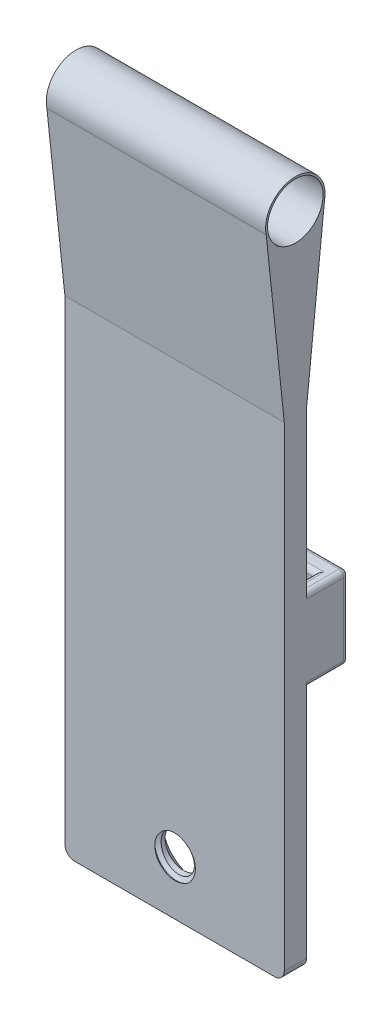
from build123d import *

# Parameters (mm, degrees)
SKETCH1_R           = 3.05
SKETCH1_R_2         = 2.85
BOSS_EXTRUDE1_DEPTH = 22.5
THREAD1_PITCH       = 0.79375
CUT_EXTRUDE1_REACH  = 73.638
SKETCH12_R          = 2.85
SKETCH13_W          = 4.3
SKETCH13_H          = 8.396908484
BOSS_EXTRUDE2_DEPTH = 22.5
CUT_EXTRUDE2_REACH  = 53.493
SKETCH14_W          = 19.5
SKETCH14_H          = 2.3
FILLET1_R           = 1
FILLET2_R           = 0.5


with BuildPart() as part:
    # Sketch1 → Boss-Extrude1 (new body)
    with BuildSketch(Plane(origin=(0, 0, 0), x_dir=(0, 0, -1), z_dir=(1, 0, 0))):
        with Locations(Location((0, 0, 0), (0, 0, 180))):
            Circle(SKETCH1_R)
        with Locations(Location((0, 0, 0), (0, 0, 180))):
            Circle(SKETCH1_R_2, mode=Mode.SUBTRACT)
    extrude(amount=BOSS_EXTRUDE1_DEPTH)

    # Sweep1: sweep along a path in Sketch4
    with BuildLine(Plane(origin=(0, -2.85, 0), x_dir=(-1, 0, 0), z_dir=(0, -1, 0))) as sweep1_path:
        Line((0, 0), (-22.5, 0))
    # Sketch3 → Sweep1 (sweep)
    with BuildSketch(Plane(origin=(0, 0, 0), x_dir=(0, 0, -1), z_dir=(1, 0, 0))):
        Polygon((-3.05, 0), (3.05, 0), (1.163985807, -17.9442264), (1.163985807, -67.9442264), (-1.136014193, -67.9442264), (-1.136014193, -18.210358526), align=None)
    sweep(path=sweep1_path.line)

    # Sketch7 → CSK for #6 Flat Head Machine Screw (100)1 (revolve, cut)
    with BuildSketch(Plane(origin=(11.25, -62.1942264, -1.163985807), x_dir=(0, 1, 0), z_dir=(1, 0, 0))):
        Polygon((0, 0), (0, 2.3), (1.89865, 2.3), (1.89865, 1.380025208), (3.5433, 0), align=None)
    revolve(axis=Axis((11.25, -62.1942264, -7.513985807), (0, 0, 1)), mode=Mode.SUBTRACT)

    # Thread1: the profile of Thread Profile1 profile screwed along a right-hand helix of 1.159023 turns, 8 arcs to a turn; built about Z, then put on its axis
    thread1_z = Axis((0, 0, 0), (0, 0, 1))
    thread1_corners = [(1.89835, 0, -0.000173205), (2.328279788, 0, 0.248046874), (2.328279788, 0, 0.347265624), (1.89835, 0, 0.595485703)]
    with BuildLine(mode=Mode.PRIVATE) as thread1_profile:
        Line(thread1_corners[0], thread1_corners[1])
        Line(thread1_corners[1], thread1_corners[2])
        Line(thread1_corners[2], thread1_corners[3])
        Line(thread1_corners[3], thread1_corners[0])
    thread1_cap = Face(thread1_profile.wire())
    thread1_turn_angles = [0, 22.5, 45, 67.5, 90, 112.5, 135, 157.5, 180, 202.5, 225, 247.5, 270, 292.5, 315, 337.5, 360]
    thread1_turn_weights = [1, 0.9238795325112867, 1, 0.9238795325112867, 1, 0.9238795325112867, 1, 0.9238795325112867, 1, 0.9238795325112867, 1, 0.9238795325112867, 1, 0.9238795325112867, 1, 0.9238795325112867, 1]
    thread1_turn_rails = [Edge.make_bspline([Vector(p[0], p[1], 0).rotate(thread1_z, thread1_turn_angles[k]) / thread1_turn_weights[k] + Vector(0, 0, p[2] + THREAD1_PITCH * thread1_turn_angles[k] / 360) for k in range(17)], [0, 0, 0, 1, 1, 2, 2, 3, 3, 4, 4, 5, 5, 6, 6, 7, 7, 8, 8, 8], 2, thread1_turn_weights) for p in thread1_corners]
    thread1_turn_sides = [Face.make_surface_from_curves(thread1_turn_rails[p[0]], thread1_turn_rails[p[1]]) for p in [(0, 1), (1, 2), (2, 3), (3, 0)]]
    thread1_last_angles = [360, 382.5, 405, 411.124204706, 417.248409411]
    thread1_last_weights = [1, 0.9238795325112867, 1, 0.9942929639578036, 1]
    thread1_last_rails = [Edge.make_bspline([Vector(p[0], p[1], 0).rotate(thread1_z, thread1_last_angles[k]) / thread1_last_weights[k] + Vector(0, 0, p[2] + THREAD1_PITCH * thread1_last_angles[k] / 360) for k in range(5)], [0, 0, 0, 1, 1, 2, 2, 2], 2, thread1_last_weights) for p in thread1_corners]
    thread1_last_sides = [Face.make_surface_from_curves(thread1_last_rails[p[0]], thread1_last_rails[p[1]]) for p in [(0, 1), (1, 2), (2, 3), (3, 0)]]
    thread1 = Plane(origin=(11.25, -62.1942264, 0.216039402), x_dir=(1, 0, 0), z_dir=(0, 0, 1)) * Solid(Shell([*thread1_turn_sides, *thread1_last_sides, thread1_cap, thread1_cap.rotate(thread1_z, 417.248409411).moved(Location((0, 0, THREAD1_PITCH * 417.248409411 / 360)))]))
    add(thread1, mode=Mode.SUBTRACT)

    # Sketch12 → Cut-Extrude1 (cut, up to next)
    with BuildSketch(Plane(origin=(22.5, 0, 0), x_dir=(0, 0, -1), z_dir=(1, 0, 0)), mode=Mode.PRIVATE) as cut_extrude1_sk1:
        with Locations(Location((0, 0, 0), (0, 0, 180))):
            Circle(SKETCH12_R)
    cut_extrude1_tool1 = extrude(cut_extrude1_sk1.sketch, amount=-CUT_EXTRUDE1_REACH, mode=Mode.PRIVATE) & part.part
    add(cut_extrude1_tool1.solids().sort_by_distance((22.5, 0, 0))[0], mode=Mode.SUBTRACT)

    # Sketch13 → Boss-Extrude2 (add)
    with BuildSketch(Plane(origin=(22.5, 0, 0), x_dir=(0, 0, -1), z_dir=(1, 0, 0))):
        with Locations((3.313985807, -38.745772158)):
            Rectangle(SKETCH13_W, SKETCH13_H)
    extrude(amount=-BOSS_EXTRUDE2_DEPTH)

    # Sketch14 → Cut-Extrude2 (cut, up to next)
    with BuildSketch(Plane.XZ.offset(42.9442264), mode=Mode.PRIVATE) as cut_extrude2_sk1:
        with Locations((11.25, -2.313985807)):
            Rectangle(SKETCH14_W, SKETCH14_H)
    cut_extrude2_tool1 = extrude(cut_extrude2_sk1.sketch, amount=-CUT_EXTRUDE2_REACH, mode=Mode.PRIVATE) & part.part
    add(cut_extrude2_tool1.solids().sort_by_distance((11.25, -42.944226, -2.313986))[0], mode=Mode.SUBTRACT)

    # Fillet1
    fillet1_edges = [part.edges().sort_by_distance(p)[0] for p in [
        (22.5, -67.9442264, -0.013985807),
        (0, -67.9442264, -0.013985807),
    ]]
    fillet(fillet1_edges, radius=FILLET1_R)

    # Fillet2
    fillet2_edges = [part.edges().sort_by_distance(p)[0] for p in [
        (0, -34.547317916, -3.313985807),
        (0, -38.745772158, -5.463985807),
        (11.25, -34.547317916, -5.463985807),
        (0, -42.9442264, -3.313985807),
        (11.25, -42.9442264, -5.463985807),
        (22.5, -42.9442264, -3.313985807),
        (22.5, -38.745772158, -5.463985807),
        (22.5, -34.547317916, -3.313985807),
        (1.5, -42.9442264, -2.313985807),
        (11.25, -42.9442264, -3.463985807),
        (21, -42.9442264, -2.313985807),
        (11.25, -34.547317916, -3.463985807),
        (21, -34.547317916, -2.313985807),
        (1.5, -34.547317916, -2.313985807),
    ]]
    fillet(fillet2_edges, radius=FILLET2_R)


solid = part.part
